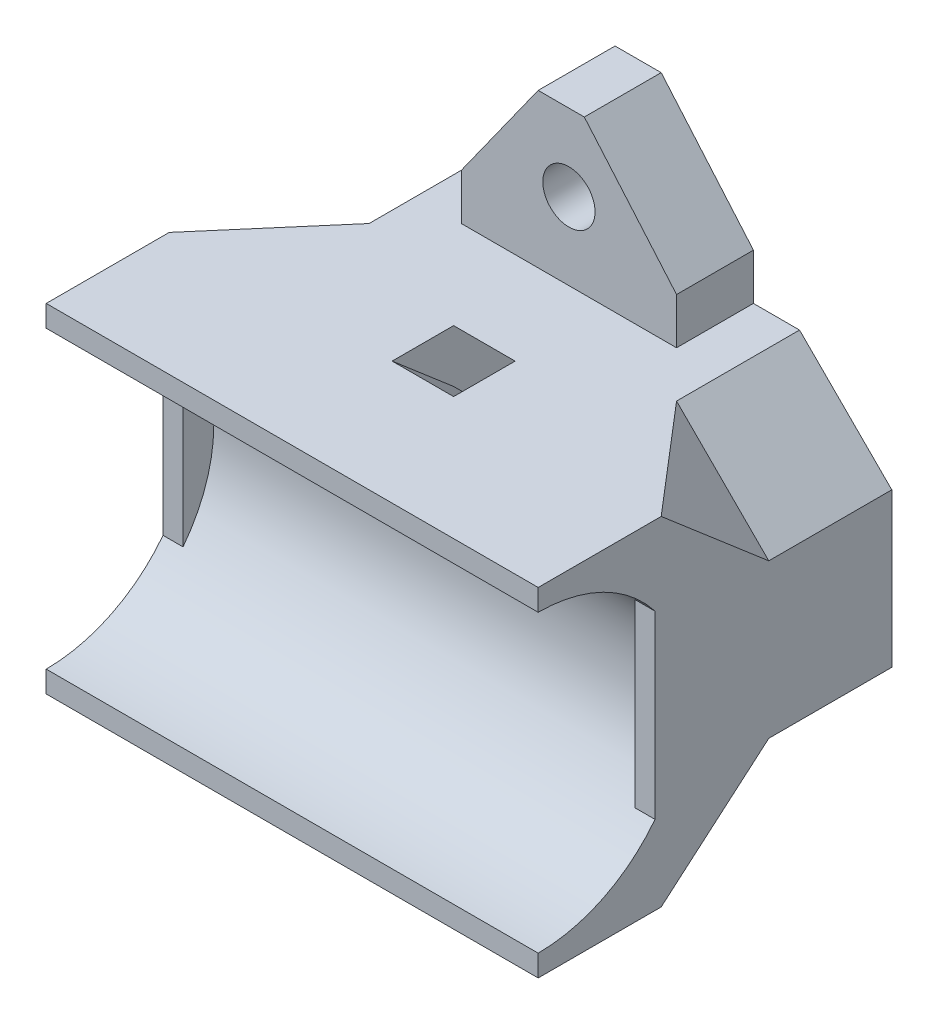
from build123d import *
from OCP.BRepFilletAPI import BRepFilletAPI_MakeChamfer
from build123d.topology import SkipClean

# Parameters (mm, degrees)
BOSS_EXTRU_1_DEPTH           = 15
ENL_V_START                  = -1.3
ESQUISSE2_R                  = 9.6
ENL_V_MAT_EXTRU_1_DEPTH      = 29.4
ENL_V_MAT_EXTRU_2_DEPTH      = 36.895542898805694
ENL_V_MAT_EXTRU_2_DEPTH_BACK = 36.895542898805694
BOSS_EXTRU_2_DEPTH           = 3
ESQUISSE6_R                  = 1.7
ENL_V_MAT_EXTRU_3_DEPTH      = 30.000000000000014
CHANFREIN1_SIZE              = 5
CHANFREIN1_SIZE2             = 7
CHANFREIN2_SIZE              = 7
CHANFREIN2_SIZE2             = 6
CHANFREIN3_START             = 12.698865856
CHANFREIN3_OUTLINE_W         = 11
CHANFREIN3_OUTLINE_H         = 12.000000000000002
CHANFREIN3_DEPTH             = 4.301134144
CHANFREIN4_START             = 12.698865856
CHANFREIN4_OUTLINE_W         = 11
CHANFREIN4_OUTLINE_H         = 12.000000000000002
CHANFREIN4_DEPTH             = 4.301134144
CHANFREIN5_START             = -17
CHANFREIN5_OUTLINE_W         = 11
CHANFREIN5_OUTLINE_H         = 12.000000000000002
CHANFREIN5_DEPTH             = 4.301134144
CHANFREIN6_START             = -17
CHANFREIN6_OUTLINE_W         = 11
CHANFREIN6_OUTLINE_H         = 12.000000000000002
CHANFREIN6_DEPTH             = 4.301134144
ENL_V_START_2                = -13.5
ENL_V_MAT_EXTRU_4_DEPTH      = 4
ESQUISSE10_R                 = 1.6999999999999995
ESQUISSE10_R_2               = 1.7000000000000002
ESQUISSE10_W                 = 4
ESQUISSE10_H                 = 16.857142857142858
BOSS_EXTRU_3_DEPTH           = 8
ESQUISSE12_W                 = 14
ESQUISSE12_H                 = 9.999999999999995
ESQUISSE12_W_2               = 14.000000000000002
ESQUISSE12_H_2               = 9.999999999999996
ENL_V_MAT_EXTRU_6_DEPTH      = 6


with BuildPart() as part:
    # Esquisse1 → Boss.-Extru.1 (new body)
    with BuildSketch(Plane.XY):
        Polygon((-16.000000000000007, 11.000000000000002), (15.999999999999993, 11.000000000000002), (15.999999999999996, -11), (-16, -11), align=None)
    extrude(amount=BOSS_EXTRU_1_DEPTH)

    # Esquisse2 → Enlèv. mat.-Extru.1 (cut)
    with BuildSketch(Plane(origin=(15.999999999999996, 2.52e-15, 0), x_dir=(0, 0, -1), z_dir=(1, 1.6e-16, 0)).offset(ENL_V_START)):
        with Locations((-15, -1.73e-15)):
            Circle(ESQUISSE2_R)
    extrude(amount=-ENL_V_MAT_EXTRU_1_DEPTH, mode=Mode.SUBTRACT)

    # Esquisse4 → Enlèv. mat.-Extru.2 (cut, two sides: drawn at the far end of the back side and taken through both)
    with SkipClean():  # the faces are left unmerged after this step: merging them gives an invalid solid
        with BuildSketch(Plane(origin=(-14.700000000000001, -2.32e-15, 0), x_dir=(0, 0, -1), z_dir=(1, 1.6e-16, 0)).offset(-ENL_V_MAT_EXTRU_2_DEPTH_BACK)):
            with BuildLine():
                Line((-7.3999999999999995, -5.865151319446073), (-7.3999999999999995, 5.865151319446073))
                ThreePointArc((-7.3999999999999995, 5.865151319446073), (-10.76593886833709, 8.615841591704243), (-15.000000000000032, 9.599999999999998))
                Line((-15.000000000000032, 9.599999999999998), (-15, -9.600000000000001))
                ThreePointArc((-15, -9.600000000000001), (-10.765938868337066, -8.615841591704251), (-7.3999999999999995, -5.865151319446073))
            make_face()
        extrude(amount=ENL_V_MAT_EXTRU_2_DEPTH + ENL_V_MAT_EXTRU_2_DEPTH_BACK, mode=Mode.SUBTRACT)

    # Esquisse5 → Boss.-Extru.2 (add)
    with BuildSketch(Plane(origin=(0, 0, 0), x_dir=(-1, 0, 0), z_dir=(0, 0, -1))):
        Polygon((7.000000000000008, -11), (-6.999999999999992, -11.000000000000002), (-6.999999999999991, -20.999999999999993), (7.000000000000009, -20.999999999999996), align=None)
        Polygon((7.000000000000006, 11.000000000000002), (-6.999999999999994, 11), (-6.999999999999992, 20.999999999999996), (7.000000000000008, 20.999999999999996), align=None)
    extrude(amount=-BOSS_EXTRU_2_DEPTH)

    # Esquisse6 → Enlèv. mat.-Extru.3 (cut, through all)
    with BuildSketch(Plane.XY.offset(3)):
        with Locations((0, -15.999999999999996)):
            Circle(ESQUISSE6_R)
        with Locations((8.7e-16, 15.999999999999996)):
            Circle(ESQUISSE6_R)
    extrude(amount=-ENL_V_MAT_EXTRU_3_DEPTH, mode=Mode.SUBTRACT)

    # Chanfrein1: one chamfer whose edges measure the first distance from different faces: ONE call of the kernel's chamfer builder (chamfer() names one face for all edges)
    chanfrein1_edges_1 = [part.edges().sort_by_distance(p)[0] for p in [
        (6.999999999999991, -20.999999999999993, 1.5),
    ]]
    chanfrein1_side_1 = [part.faces().sort_by_distance(p)[0] for p in [
        (-9.13e-15, -20.999999999999993, 1.5),
    ]]
    chanfrein1_edges_2 = [part.edges().sort_by_distance(p)[0] for p in [
        (-7.000000000000008, 20.999999999999996, 1.5),
    ]]
    chanfrein1_side_2 = [part.faces().sort_by_distance(p)[0] for p in [
        (-8.24e-15, 20.999999999999996, 1.5),
    ]]
    chanfrein1 = BRepFilletAPI_MakeChamfer(part.part.solid().wrapped)
    for e in chanfrein1_edges_1:
        chanfrein1.Add(CHANFREIN1_SIZE, CHANFREIN1_SIZE2, e.wrapped, chanfrein1_side_1[0].wrapped)  # the first distance lies on this face
    for e in chanfrein1_edges_2:
        chanfrein1.Add(CHANFREIN1_SIZE, CHANFREIN1_SIZE2, e.wrapped, chanfrein1_side_2[0].wrapped)  # the first distance lies on this face
    add(Compound.cast(chanfrein1.Shape()), mode=Mode.REPLACE)

    # Chanfrein2: one chamfer whose edges measure the first distance from different faces: ONE call of the kernel's chamfer builder (chamfer() names one face for all edges)
    chanfrein2_edges_1 = [part.edges().sort_by_distance(p)[0] for p in [
        (6.999999999999992, 20.999999999999996, 1.5),
    ]]
    chanfrein2_side_1 = [part.faces().sort_by_distance(p)[0] for p in [
        (6.999999999999993, 15.999999999999998, 1.5),
    ]]
    chanfrein2_edges_2 = [part.edges().sort_by_distance(p)[0] for p in [
        (-7.000000000000009, -20.999999999999996, 1.5),
    ]]
    chanfrein2_side_2 = [part.faces().sort_by_distance(p)[0] for p in [
        (-7.000000000000009, -15.999999999999998, 1.5),
    ]]
    chanfrein2 = BRepFilletAPI_MakeChamfer(part.part.solid().wrapped)
    for e in chanfrein2_edges_1:
        chanfrein2.Add(CHANFREIN2_SIZE, CHANFREIN2_SIZE2, e.wrapped, chanfrein2_side_1[0].wrapped)  # the first distance lies on this face
    for e in chanfrein2_edges_2:
        chanfrein2.Add(CHANFREIN2_SIZE, CHANFREIN2_SIZE2, e.wrapped, chanfrein2_side_2[0].wrapped)  # the first distance lies on this face
    add(Compound.cast(chanfrein2.Shape()), mode=Mode.REPLACE)

    # Chanfrein3: read off the stored shape, not the designer's step
    # Chanfrein3 outline → Chanfrein3 (cut)
    with BuildSketch(Plane(origin=(0, 0, 0), x_dir=(0.7964473354898962, 0.4591284639882932, 0.39353868341853704), z_dir=(0.6047078979069521, -0.6047078979069521, -0.5183210553488161)).offset(CHANFREIN3_START)):
        with Locations((6.5, 8)):
            Rectangle(CHANFREIN3_OUTLINE_W, CHANFREIN3_OUTLINE_H)
    extrude(amount=CHANFREIN3_DEPTH, mode=Mode.SUBTRACT)

    # Chanfrein4: read off the stored shape, not the designer's step
    # Chanfrein4 outline → Chanfrein4 (cut)
    with BuildSketch(Plane(origin=(0, 0, 0), x_dir=(0.7964473354898962, -0.45912846398829327, 0.39353868341853704), z_dir=(0.6047078979069521, 0.6047078979069522, -0.5183210553488161)).offset(CHANFREIN4_START)):
        with Locations((6.5, -8)):
            Rectangle(CHANFREIN4_OUTLINE_W, CHANFREIN4_OUTLINE_H)
    extrude(amount=CHANFREIN4_DEPTH, mode=Mode.SUBTRACT)

    # Chanfrein5: read off the stored shape, not the designer's step
    # Chanfrein5 outline → Chanfrein5 (cut)
    with BuildSketch(Plane(origin=(0, 0, 0), x_dir=(0.7964473354898962, 0.45912846398829327, -0.39353868341853704), z_dir=(0.6047078979069521, -0.6047078979069522, 0.5183210553488161)).offset(CHANFREIN5_START)):
        with Locations((-6.5, 8)):
            Rectangle(CHANFREIN5_OUTLINE_W, CHANFREIN5_OUTLINE_H)
    extrude(amount=CHANFREIN5_DEPTH, mode=Mode.SUBTRACT)

    # Chanfrein6: read off the stored shape, not the designer's step
    # Chanfrein6 outline → Chanfrein6 (cut)
    with BuildSketch(Plane(origin=(0, 0, 0), x_dir=(0.796447335489896, -0.45912846398829327, -0.39353868341853715), z_dir=(0.6047078979069522, 0.6047078979069521, 0.5183210553488161)).offset(CHANFREIN6_START)):
        with Locations((-6.5, -8)):
            Rectangle(CHANFREIN6_OUTLINE_W, CHANFREIN6_OUTLINE_H)
    extrude(amount=CHANFREIN6_DEPTH, mode=Mode.SUBTRACT)

    # Esquisse7 → Enlèv. mat.-Extru.4 (cut)
    with BuildSketch(Plane(origin=(15.999999999999996, 2.52e-15, 0), x_dir=(0, 0, -1), z_dir=(1, 1.6e-16, 0)).offset(ENL_V_START_2)):
        Polygon((-3, -7.571428571428581), (-3, 7.571428571428564), (-7.000000000000009, 11), (-3.000000000000009, 11), (-4.5e-16, 8.428571428571422), (1.83e-15, -8.428571428571436), (-2.999999999999989, -11.000000000000002), (-6.9999999999999885, -11.000000000000002), align=None)
    extrude(amount=-ENL_V_MAT_EXTRU_4_DEPTH, mode=Mode.SUBTRACT)

    # Esquisse10 → Boss.-Extru.3 (add)
    with BuildSketch(Plane(origin=(0, 0, 0), x_dir=(-1, 0, 0), z_dir=(0, 0, -1))):
        Polygon((-9.999999999999998, -11.000000000000004), (-15.999999999999996, -5.000000000000007), (-15.999999999999993, 4.999999999999996), (-9.999999999999995, 11), (-6.999999999999994, 11), (-6.999999999999993, 13.999999999999977), (-0.9999999999999818, 20.999999999999996), (1.999999999999995, 20.999999999999996), (7.000000000000008, 13.999999999999968), (7.000000000000006, 11.000000000000002), (10.000000000000009, 11.000000000000004), (16.000000000000004, 5.000000000000002), (16.000000000000007, -4.999999999999992), (9.999999999999993, -11), (7.000000000000008, -11), (7.000000000000008, -13.999999999999963), (0.99999999999999, -20.999999999999996), (-1.9999999999999645, -20.999999999999993), (-6.999999999999992, -13.999999999999954), (-6.999999999999992, -11), align=None)
        with Locations(Location((-8.7e-16, 15.999999999999996, 0), (0, 0, 180))):
            Circle(ESQUISSE10_R, mode=Mode.SUBTRACT)
        with Locations(Location((0, -15.999999999999996, 0), (0, 0, 180))):
            Circle(ESQUISSE10_R_2, mode=Mode.SUBTRACT)
        with Locations((-0.499999999999997, -7.11e-15)):
            Rectangle(ESQUISSE10_W, ESQUISSE10_H, mode=Mode.SUBTRACT)
    extrude(amount=BOSS_EXTRU_3_DEPTH)

    # Esquisse12 → Enlèv. mat.-Extru.6 (cut)
    with BuildSketch(Plane.XY.offset(3)):
        with Locations((-5.77e-15, 16)):
            Rectangle(ESQUISSE12_W, ESQUISSE12_H)
        with Locations((-7.11e-15, -15.999999999999998)):
            Rectangle(ESQUISSE12_W_2, ESQUISSE12_H_2)
    extrude(amount=-ENL_V_MAT_EXTRU_6_DEPTH, mode=Mode.SUBTRACT)


solid = part.part
